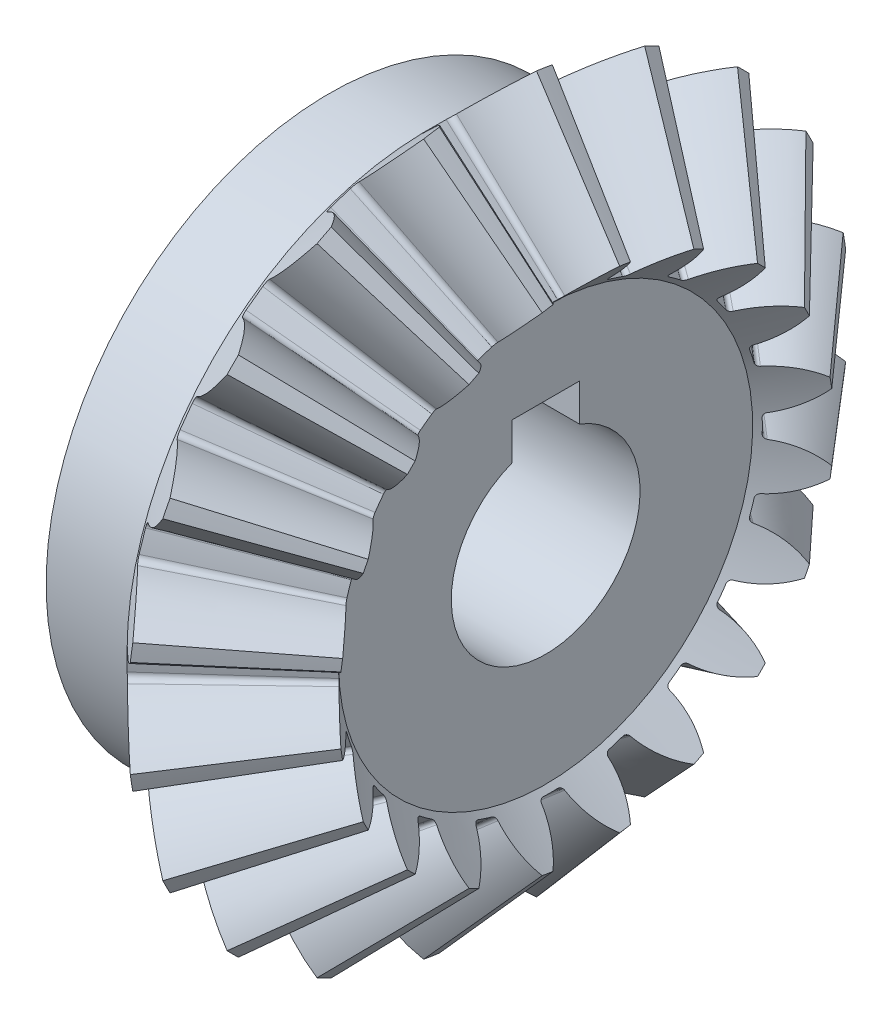
from build123d import *

# Parameters (mm, degrees)
TEETHCUTS_COUNT = 20
TEETHCUTS_ANGLE = 342
HUBSKE_R        = 21
HUB_DEPTH       = 7.374083791
BORSKE_R        = 7
BORE_DEPTH      = 35.0000508
KEYSKE_W        = 5
KEYSKE_H        = 9.3
KEYWAY_DEPTH    = 35.0000508


with BuildPart() as part:
    # BasProSke → Base-Revolve (revolve)
    with BuildSketch(Plane(origin=(0, 0, 0), x_dir=(1, 0, 0), z_dir=(0, 1, 0)), mode=Mode.PRIVATE) as base_revolve_sk:
        Polygon((0, 0), (0, 22.373982194), (4.393784766, 26.767766951), (11.687670029, 18.363881673), (8.673337766, 15.349549416), (8.673337766, 0), align=None)
    revolve(base_revolve_sk.sketch.rotate(Axis((-10, 0, 0), (1, 0, 0)), 180), axis=Axis((-10, 0, 0), (1, 0, 0)))

    # ToothCut: read off the stored shape, not the designer's step
    # ToothCut: loft between two sections, ruled curve by curve
    toothcut_from = [
        Edge.make_bspline([(27.632061775, 0.006043964, -0.009393107), (27.627836962, 0.001819151, -0.01483001), (27.622153271, -0.00386454, -0.014024229), (27.618775653, -0.007242158, -0.007509524)], [0, 0, 0, 0, 1, 1, 1, 1], 3, [1, 0.77919554, 0.77919554, 1]),
        Edge.make_bspline([(27.618775653, -0.007242158, 0.007509524), (27.622153271, -0.00386454, 0.014024229), (27.627836962, 0.001819151, 0.01483001), (27.632061775, 0.006043964, 0.009393107)], [0, 0, 0, 0, 1, 1, 1, 1], 3, [1, 0.77919554, 0.77919554, 1]),
        Edge.make_bspline([(27.618775653, -0.007242158, -0.007509524), (27.618275945, -0.007741866, -0.006545694), (27.617876746, -0.008141065, -0.005492289), (27.617585944, -0.008431867, -0.004370125)], [0, 0, 0, 0, 1, 1, 1, 1], 3, [1, 0.993412679, 0.993412679, 1]),
        Edge.make_bspline([(27.617585944, -0.008431867, 0.004370125), (27.617876746, -0.008141065, 0.005492289), (27.618275945, -0.007741866, 0.006545694), (27.618775653, -0.007242158, 0.007509524)], [0, 0, 0, 0, 1, 1, 1, 1], 3, [1, 0.993412679, 0.993412679, 1]),
        Edge.make_bspline([(27.617585944, -0.008431867, -0.004370125), (27.61684697, -0.009170841, -0.001518531), (27.61684697, -0.009170841, 0.001518531), (27.617585944, -0.008431867, 0.004370125)], [0, 0, 0, 0, 1, 1, 1, 1], 3, [1, 0.959287609, 0.959287609, 1]),
        Edge.make_line((27.632061775, 0.006043964, 0.009393107), (27.632061775, 0.006043964, -0.009393107)),
    ]
    toothcut_to = [
        Edge.make_bspline([(4.57837287, 26.952355056, -4.015814914), (3.539433303, 25.91341549, -2.552366841), (2.236900352, 24.610882542, -1.599850731), (0.791930966, 23.165913159, -1.246866219)], [0, 0, 0, 0, 1, 1, 1, 1], 3, [1, 0.968994528, 0.968994528, 1]),
        Edge.make_bspline([(0.791930966, 23.165913159, 1.246866219), (2.236900352, 24.610882542, 1.599850731), (3.539433303, 25.91341549, 2.552366841), (4.57837287, 26.952355056, 4.015814914)], [0, 0, 0, 0, 1, 1, 1, 1], 3, [1, 0.968994528, 0.968994528, 1]),
        Edge.make_bspline([(0.791930966, 23.165913159, -1.246866219), (0.61984468, 22.993826873, -1.204828101), (0.509699618, 22.883681811, -1.013175515), (0.515774885, 22.889757078, -0.766354192)], [0, 0, 0, 0, 1, 1, 1, 1], 3, [1, 0.835734487, 0.835734487, 1]),
        Edge.make_bspline([(0.515774885, 22.889757078, 0.766354192), (0.509699618, 22.883681811, 1.013175515), (0.61984468, 22.993826873, 1.204828101), (0.791930966, 23.165913159, 1.246866219)], [0, 0, 0, 0, 1, 1, 1, 1], 3, [1, 0.835734487, 0.835734487, 1]),
        Edge.make_bspline([(0.515774885, 22.889757078, -0.766354192), (0.528347723, 22.902329916, -0.255554522), (0.528347723, 22.902329916, 0.255554522), (0.515774885, 22.889757078, 0.766354192)], [0, 0, 0, 0, 1, 1, 1, 1], 3, [1, 0.999596466, 0.999596466, 1]),
        Edge.make_line((4.57837287, 26.952355056, 4.015814914), (4.57837287, 26.952355056, -4.015814914)),
    ]
    toothcut = Solid(Shell([*[Face.make_surface_from_curves(toothcut_from[k], toothcut_to[k]) for k in range(6)], Face(Wire(toothcut_from)), Face(Wire(toothcut_to))]))
    add(toothcut, mode=Mode.SUBTRACT)

    # TeethCuts: ToothCut ×20 about axis
    teethcuts_axis = Axis((-10, 0, 0), (1, 0, 0))
    for i in range(1, TEETHCUTS_COUNT):
        add(toothcut.rotate(teethcuts_axis, i * TEETHCUTS_ANGLE / (TEETHCUTS_COUNT - 1)), mode=Mode.SUBTRACT)

    # HubSke → Hub (add)
    with BuildSketch(Plane.ZY):
        with Locations(Location((0, 0, 0), (0, 0, 180))):
            Circle(HUBSKE_R)
    extrude(amount=HUB_DEPTH)

    # BorSke → Bore (cut, symmetric)
    with BuildSketch(Plane(origin=(0, 0, 0), x_dir=(0, 0, -1), z_dir=(1, 0, 0))):
        with Locations(Location((0, 0, 0), (0, 0, 180))):
            Circle(BORSKE_R)
    extrude(amount=BORE_DEPTH, both=True, mode=Mode.SUBTRACT)

    # KeySke → Keyway (cut, symmetric)
    with BuildSketch(Plane(origin=(0, 0, 0), x_dir=(0, 0, -1), z_dir=(1, 0, 0))):
        with Locations((0, 4.65)):
            Rectangle(KEYSKE_W, KEYSKE_H)
    extrude(amount=KEYWAY_DEPTH, both=True, mode=Mode.SUBTRACT)


solid = part.part
